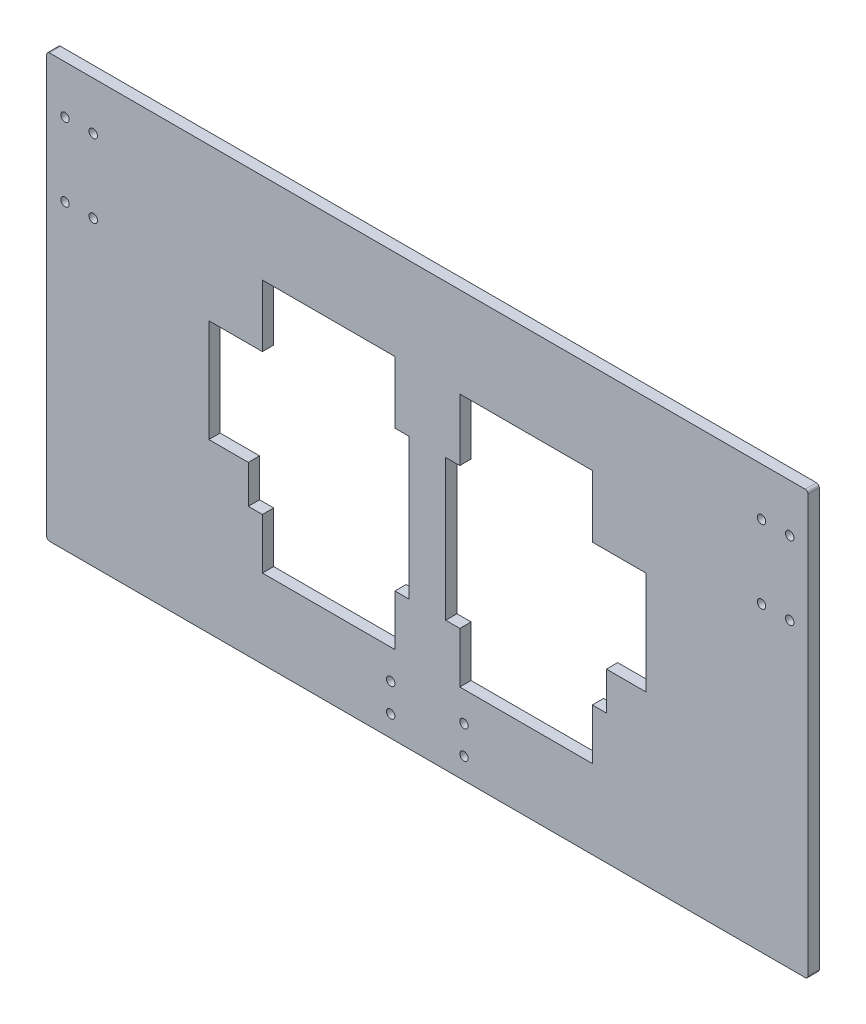
from build123d import *

# Parameters (mm, degrees)
SKETCH_1_W             = 270
SKETCH_1_H             = 150
SM_BASE_FLANGE_1_DEPTH = 4
FILLET_1_R             = 1
SKETCH_2_R             = 1.5
CUT_EXTRUDE_1_DEPTH    = 10
SKETCH_3_R             = 1.5
CUT_EXTRUDE_2_DEPTH    = 10
SKETCH_4_W             = 47
SKETCH_4_H             = 90
CUT_EXTRUDE_3_DEPTH    = 10
SKETCH_5_W             = 57
SKETCH_5_H             = 50
CUT_EXTRUDE_4_DEPTH    = 10
SKETCH_6_W             = 14
SKETCH_6_H             = 36.5
CUT_EXTRUDE_5_DEPTH    = 10


# Sheet-metal steps are written as plain solids
with BuildPart() as part:
    # Sketch 1 → 基体-法兰1 (new body)
    with BuildSketch(Plane.XY):
        Rectangle(SKETCH_1_W, SKETCH_1_H)
    extrude(amount=-SM_BASE_FLANGE_1_DEPTH)

    # 圆角1
    fillet_1_edges = [part.edges().sort_by_distance(p)[0] for p in [
        (135, -75, -2),
        (-135, -75, -2),
        (-135, 75, -2),
        (135, 75, -2),
    ]]
    fillet(fillet_1_edges, radius=FILLET_1_R)

    # Sketch 2 → 切除-拉伸1 (cut)
    with BuildSketch(Plane(origin=(0, 0, -4), x_dir=(-1, 0, 0), z_dir=(0, 0, -1))):
        with Locations((-13, -67.5)):
            Circle(SKETCH_2_R)
        with Locations((-13, -57.5)):
            Circle(SKETCH_2_R)
        with Locations((13, -57.5)):
            Circle(SKETCH_2_R)
        with Locations((13, -67.5)):
            Circle(SKETCH_2_R)
    extrude(amount=-CUT_EXTRUDE_1_DEPTH, mode=Mode.SUBTRACT)

    # 草图3 → 切除-拉伸2 (cut)
    with BuildSketch(Plane(origin=(0, 0, -4), x_dir=(-1, 0, 0), z_dir=(0, 0, -1))):
        with Locations((-128.5, 58)):
            Circle(SKETCH_3_R)
        with Locations((-128.5, 32)):
            Circle(SKETCH_3_R)
        with Locations((-118.5, 58)):
            Circle(SKETCH_3_R)
        with Locations((-118.5, 32)):
            Circle(SKETCH_3_R)
    cut_extrude_2 = extrude(amount=-CUT_EXTRUDE_2_DEPTH, mode=Mode.SUBTRACT)

    # 镜向1: 切除-拉伸2 across plane
    add(cut_extrude_2.mirror(Plane(origin=(0, 0, 0), x_dir=(0, 0, 1), z_dir=(1, 0, 0))), mode=Mode.SUBTRACT)

    # 草图4 → 切除-拉伸3 (cut)
    with BuildSketch(Plane(origin=(0, 0, -4), x_dir=(-1, 0, 0), z_dir=(0, 0, -1))):
        with Locations((-35, -2)):
            Rectangle(SKETCH_4_W, SKETCH_4_H)
    cut_extrude_3 = extrude(amount=-CUT_EXTRUDE_3_DEPTH, mode=Mode.SUBTRACT)

    # 草图5 → 切除-拉伸4 (cut)
    with BuildSketch(Plane.XY):
        with Locations((35, -4)):
            Rectangle(SKETCH_5_W, SKETCH_5_H)
    cut_extrude_4 = extrude(amount=-CUT_EXTRUDE_4_DEPTH, mode=Mode.SUBTRACT)

    # 草图6 → 切除-拉伸5 (cut)
    with BuildSketch(Plane.XY):
        with Locations((70.5, 2.75)):
            Rectangle(SKETCH_6_W, SKETCH_6_H)
    cut_extrude_5 = extrude(amount=-CUT_EXTRUDE_5_DEPTH, mode=Mode.SUBTRACT)

    # 镜向2: 切除-拉伸3, 切除-拉伸4, 切除-拉伸5 across plane
    add(cut_extrude_3.mirror(Plane(origin=(0, 0, 0), x_dir=(0, 0, 1), z_dir=(1, 0, 0))), mode=Mode.SUBTRACT)
    add(cut_extrude_4.mirror(Plane(origin=(0, 0, 0), x_dir=(0, 0, 1), z_dir=(1, 0, 0))), mode=Mode.SUBTRACT)
    add(cut_extrude_5.mirror(Plane(origin=(0, 0, 0), x_dir=(0, 0, 1), z_dir=(1, 0, 0))), mode=Mode.SUBTRACT)


solid = part.part
